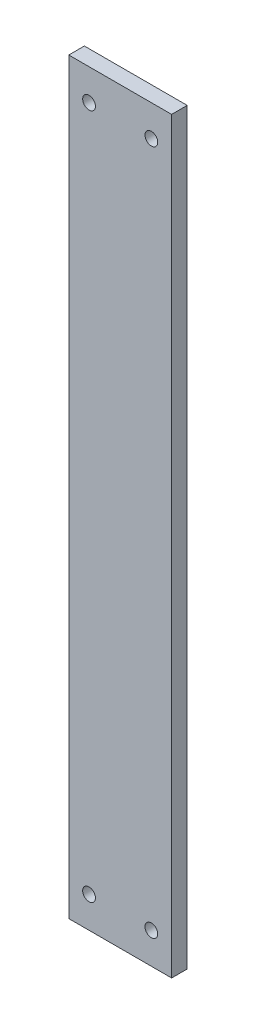
from build123d import *

# Parameters (mm, degrees)
ESQUISSE1_W        = 33
ESQUISSE1_H        = 240
ESQUISSE1_R        = 2.05
BOSS_EXTRU_1_DEPTH = 5


with BuildPart() as part:
    # Esquisse1 → Boss.-Extru.1 (new body)
    with BuildSketch(Plane.XY):
        Rectangle(ESQUISSE1_W, ESQUISSE1_H)
        with Locations((-10, 110)):
            Circle(ESQUISSE1_R, mode=Mode.SUBTRACT)
        with Locations((-10, -110)):
            Circle(ESQUISSE1_R, mode=Mode.SUBTRACT)
        with Locations((10, -110)):
            Circle(ESQUISSE1_R, mode=Mode.SUBTRACT)
        with Locations((10, 110)):
            Circle(ESQUISSE1_R, mode=Mode.SUBTRACT)
    extrude(amount=BOSS_EXTRU_1_DEPTH)


solid = part.part
